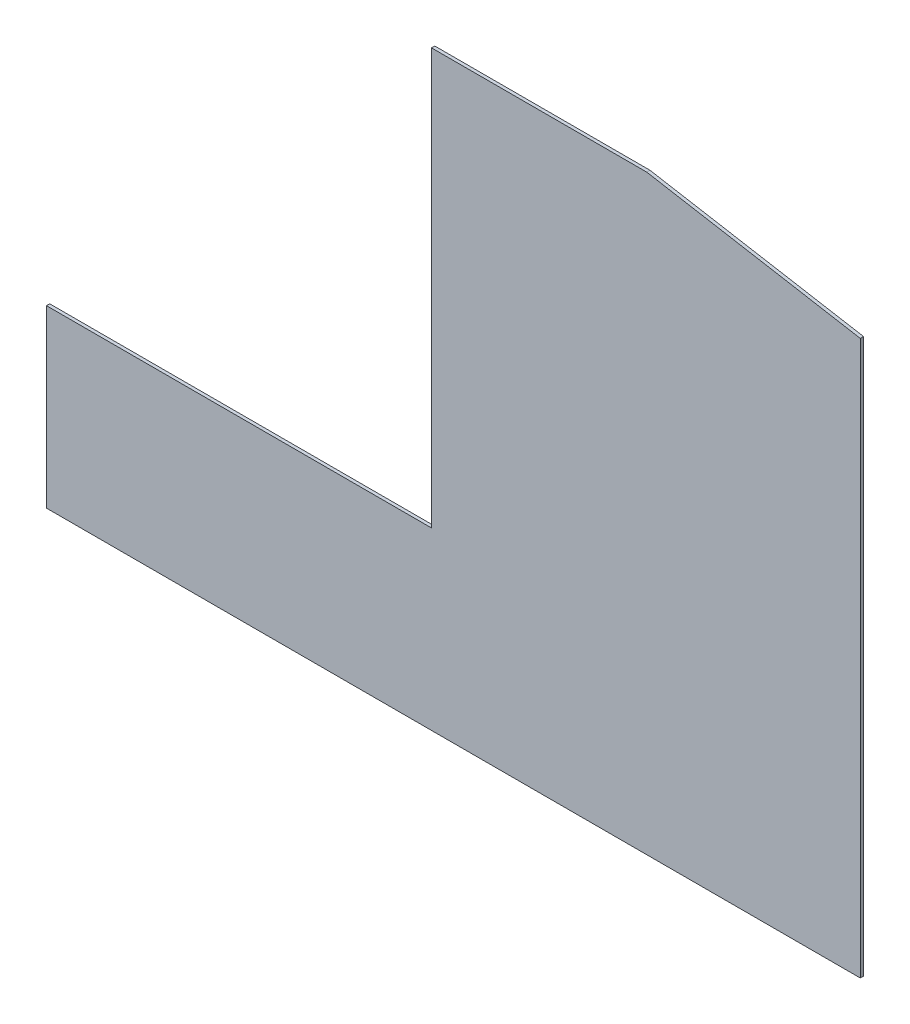
from build123d import *

# Parameters (mm, degrees)
TABAN_FLAN_1_DEPTH         = 10
KES_EKSTR_ZYON1_DEPTH      = 3114.286045323
KES_EKSTR_ZYON1_DEPTH_BACK = 3114.286045323
IZIM6_W                    = 1190
IZIM6_H                    = 1285
IZIM6_W_2                  = 2515
IZIM6_H_2                  = 8


# Sheet-metal steps are written as plain solids
with BuildPart() as part:
    # Çizim1 → Taban-Flanş1 (new body)
    with BuildSketch(Plane.XY):
        Polygon((0, 0), (0, 1720), (660, 1835), (1855, 1835), (2515, 1720), (2515, 0), align=None)
    extrude(amount=-TABAN_FLAN_1_DEPTH)

    # Çizim6 → Kes-Ekstrüzyon1 (cut, two sides: drawn at the far end of the back side and taken through both)
    with BuildSketch(Plane.XY.offset(-KES_EKSTR_ZYON1_DEPTH_BACK)):
        with Locations((595, 1192.5)):
            Rectangle(IZIM6_W, IZIM6_H)
        with Locations((1257.5, 4)):
            Rectangle(IZIM6_W_2, IZIM6_H_2)
    extrude(amount=KES_EKSTR_ZYON1_DEPTH + KES_EKSTR_ZYON1_DEPTH_BACK, mode=Mode.SUBTRACT)


solid = part.part
